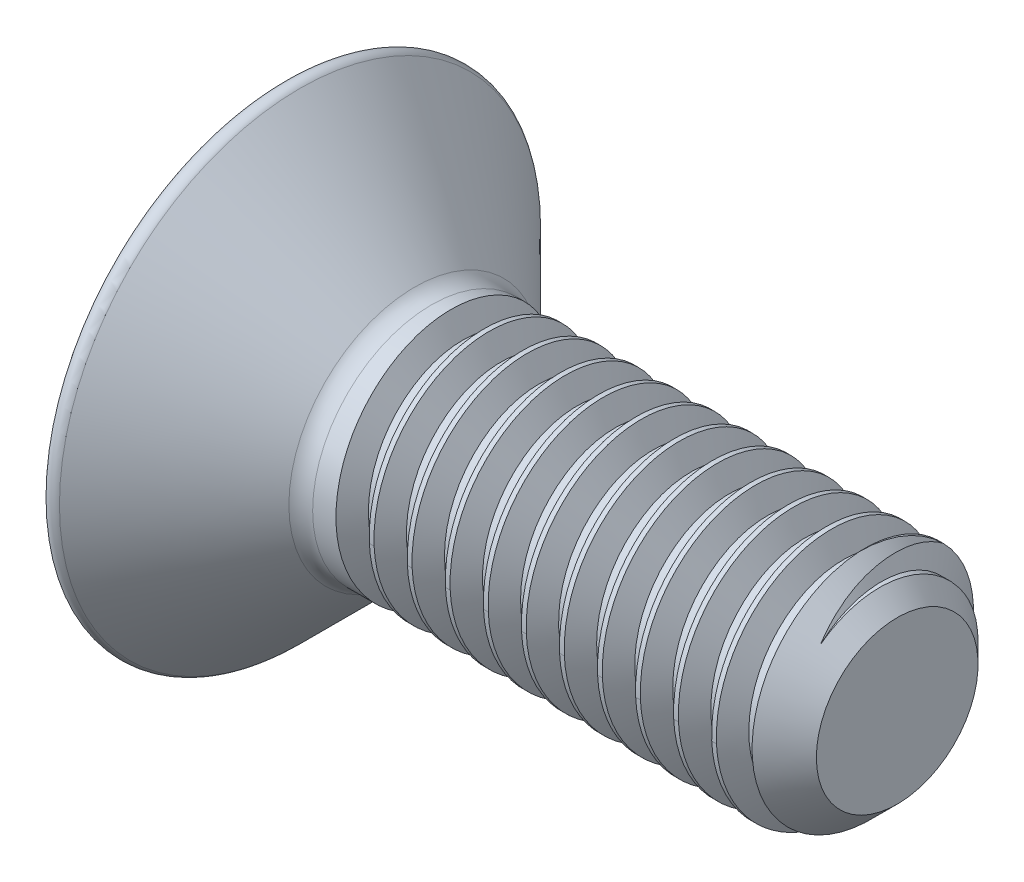
from build123d import *

# Parameters (mm, degrees)
CHAMFER1_SIZE      = 0.8
THREAD2_PITCH      = 0.8
CUT_EXTRUDE1_DEPTH = 5
FILLET1_R          = 0.2
CUT_EXTRUDE2_DEPTH = 2.05
CUT_EXTRUDE2_DRAFT = -2
FILLET2_R          = 0.1


with BuildPart() as part:
    # Sketch1 → Revolve1 (revolve)
    with BuildSketch(Plane.XY, mode=Mode.PRIVATE) as revolve1_sk:
        with BuildLine():
            Line((0, 0), (0, 5.4))
            Line((0, 5.4), (2.753553391, 2.646446609))
            ThreePointArc((2.753553391, 2.646446609), (2.915765065, 2.538060234), (3.107106781, 2.5))
            Line((3.107106781, 2.5), (12.9, 2.5))
            Line((12.9, 2.5), (12.9, 0))
            Line((12.9, 0), (0, 0))
        make_face()
    revolve(revolve1_sk.sketch.rotate(Axis((0, 0, 0), (1, 0, 0)), 90), axis=Axis((0, 0, 0), (1, 0, 0)))

    # Chamfer1
    chamfer1_edges = [part.edges().sort_by_distance(p)[0] for p in [
        (12.9, 0, -2.5),
    ]]
    chamfer(chamfer1_edges, length=CHAMFER1_SIZE)

    # Thread2: arcs per turn and ends read off the stored shape
    # Thread2: the profile of Thread Profile3 profile screwed along a right-hand helix through 11.553617 turns, 8 arcs to a turn; built about Z, then put on its axis
    thread2_z = Axis((0, 0, 0), (0, 0, 1))
    thread2_corners = [(2.5003, 0, -0.000173205), (2.5003, 0, 0.700173203), (2.0669873, 0, 0.449999999), (2.0669873, 0, 0.249999999)]
    with BuildLine(mode=Mode.PRIVATE) as thread2_profile:
        Line(thread2_corners[0], thread2_corners[1])
        Line(thread2_corners[1], thread2_corners[2])
        Line(thread2_corners[2], thread2_corners[3])
        Line(thread2_corners[3], thread2_corners[0])
    thread2_cap = Face(thread2_profile.wire())
    thread2_turn_angles = [0, 22.5, 45, 67.5, 90, 112.5, 135, 157.5, 180, 202.5, 225, 247.5, 270, 292.5, 315, 337.5, 360]
    thread2_turn_weights = [1, 0.9238795325112867, 1, 0.9238795325112867, 1, 0.9238795325112867, 1, 0.9238795325112867, 1, 0.9238795325112867, 1, 0.9238795325112867, 1, 0.9238795325112867, 1, 0.9238795325112867, 1]
    thread2_turn_rails = [Edge.make_bspline([Vector(p[0], p[1], 0).rotate(thread2_z, thread2_turn_angles[k]) / thread2_turn_weights[k] + Vector(0, 0, p[2] + THREAD2_PITCH * thread2_turn_angles[k] / 360) for k in range(17)], [0, 0, 0, 1, 1, 2, 2, 3, 3, 4, 4, 5, 5, 6, 6, 7, 7, 8, 8, 8], 2, thread2_turn_weights) for p in thread2_corners]
    thread2_turn_sides = [Face.make_surface_from_curves(thread2_turn_rails[p[0]], thread2_turn_rails[p[1]]) for p in [(0, 1), (1, 2), (2, 3), (3, 0)]]
    thread2_last_angles = [3960, 3982.5, 4005, 4027.5, 4050, 4072.5, 4095, 4117.5, 4140, 4149.651, 4159.302]
    thread2_last_weights = [1, 0.9238795325112867, 1, 0.9238795325112867, 1, 0.9238795325112867, 1, 0.9238795325112867, 1, 0.9858472026332177, 1]
    thread2_last_rails = [Edge.make_bspline([Vector(p[0], p[1], 0).rotate(thread2_z, thread2_last_angles[k]) / thread2_last_weights[k] + Vector(0, 0, p[2] + THREAD2_PITCH * thread2_last_angles[k] / 360) for k in range(11)], [0, 0, 0, 1, 1, 2, 2, 3, 3, 4, 4, 5, 5, 5], 2, thread2_last_weights) for p in thread2_corners]
    thread2_last_sides = [Face.make_surface_from_curves(thread2_last_rails[p[0]], thread2_last_rails[p[1]]) for p in [(0, 1), (1, 2), (2, 3), (3, 0)]]
    thread2 = Plane(origin=(13.1, 0, 0), x_dir=(0, 0, 1), z_dir=(-1, 0, 0)) * Solid(Shell([*[p.moved(Location((0, 0, THREAD2_PITCH * i))) for i in range(11) for p in thread2_turn_sides], *thread2_last_sides, thread2_cap, thread2_cap.rotate(thread2_z, 4159.302).moved(Location((0, 0, THREAD2_PITCH * 4159.302 / 360)))]))
    add(thread2, mode=Mode.SUBTRACT)

    # Sketch10 → Cut-Extrude1 (cut, symmetric)
    with BuildSketch(Plane(origin=(2e-09, 6.0119e-05, -2.1055e-05), x_dir=(0.999999999651825, -2.490523206109927e-05, 8.722368024214513e-06), z_dir=(2.6388449897010748e-05, 0.943792915068085, -0.33053733945038055))):
        Polygon((3.607288273, 2.0669873), (3.857288633, 2.5), (3.157288997, 2.5), (3.407288501, 2.0669873), align=None)
    extrude(amount=CUT_EXTRUDE1_DEPTH, both=True, mode=Mode.SUBTRACT)

    # Fillet1
    fillet1_edges = [part.edges().sort_by_distance(p)[0] for p in [
        (0, 0, -5.4),
    ]]
    fillet(fillet1_edges, radius=FILLET1_R)


with BuildPart() as cut_extrude2_tool:
    # Sketch11 → Cut-Extrude2 (with draft: the straight prism first)
    with BuildSketch(Plane.ZY):
        Polygon((0, 1.743597813), (-1.51, 0.871798906), (-1.51, -0.871798906), (0, -1.743597813), (1.51, -0.871798906), (1.51, 0.871798906), align=None)
    extrude(amount=-CUT_EXTRUDE2_DEPTH)
    # Cut-Extrude2: the draft: its side faces are tilted about the plane it starts from
    cut_extrude2_sides = [cut_extrude2_tool.faces().sort_by_distance(p)[0] for p in [
        (1.025, 1.30769836, -0.755),
        (1.025, 0, -1.51),
        (1.025, -1.30769836, -0.755),
        (1.025, -1.30769836, 0.755),
        (1.025, 0, 1.51),
        (1.025, 1.30769836, 0.755),
    ]]
    draft(cut_extrude2_sides, Plane.ZY, CUT_EXTRUDE2_DRAFT)


with BuildPart() as part_1:
    add(part.part)

    # Cut-Extrude2: cut by cut_extrude2_tool
    add(cut_extrude2_tool.part, mode=Mode.SUBTRACT)

    # Fillet2
    fillet2_edges = [part_1.edges().sort_by_distance(p)[0] for p in [
        (0, 0, 1.51),
        (0, 1.30769836, 0.755),
        (0, 1.30769836, -0.755),
        (0, 0, -1.51),
        (0, -1.30769836, -0.755),
        (0, -1.30769836, 0.755),
    ]]
    fillet(fillet2_edges, radius=FILLET2_R)


solid = part_1.part
